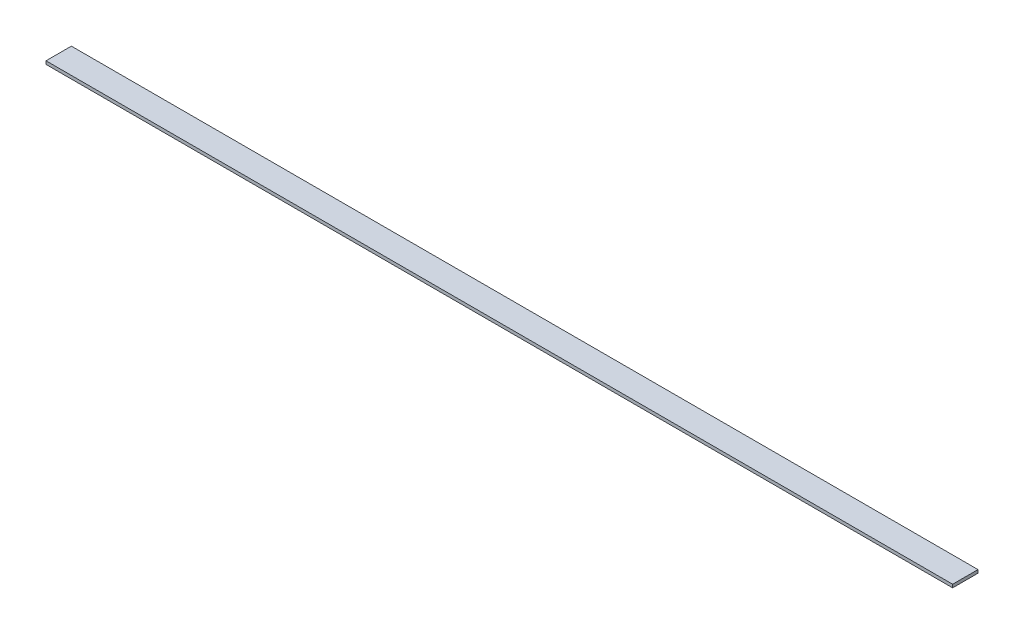
from build123d import *

# Parameters (mm, degrees)
SKETCH2_W           = 1816.1
SKETCH2_H           = 50.8
BOSS_EXTRUDE1_DEPTH = 6.35


with BuildPart() as part:
    # Sketch2 → Boss-Extrude1 (new body)
    with BuildSketch(Plane(origin=(0, 0, 0), x_dir=(1, 0, 0), z_dir=(0, 1, 0))):
        with Locations((908.05, 25.4)):
            Rectangle(SKETCH2_W, SKETCH2_H)
    extrude(amount=BOSS_EXTRUDE1_DEPTH)


solid = part.part
